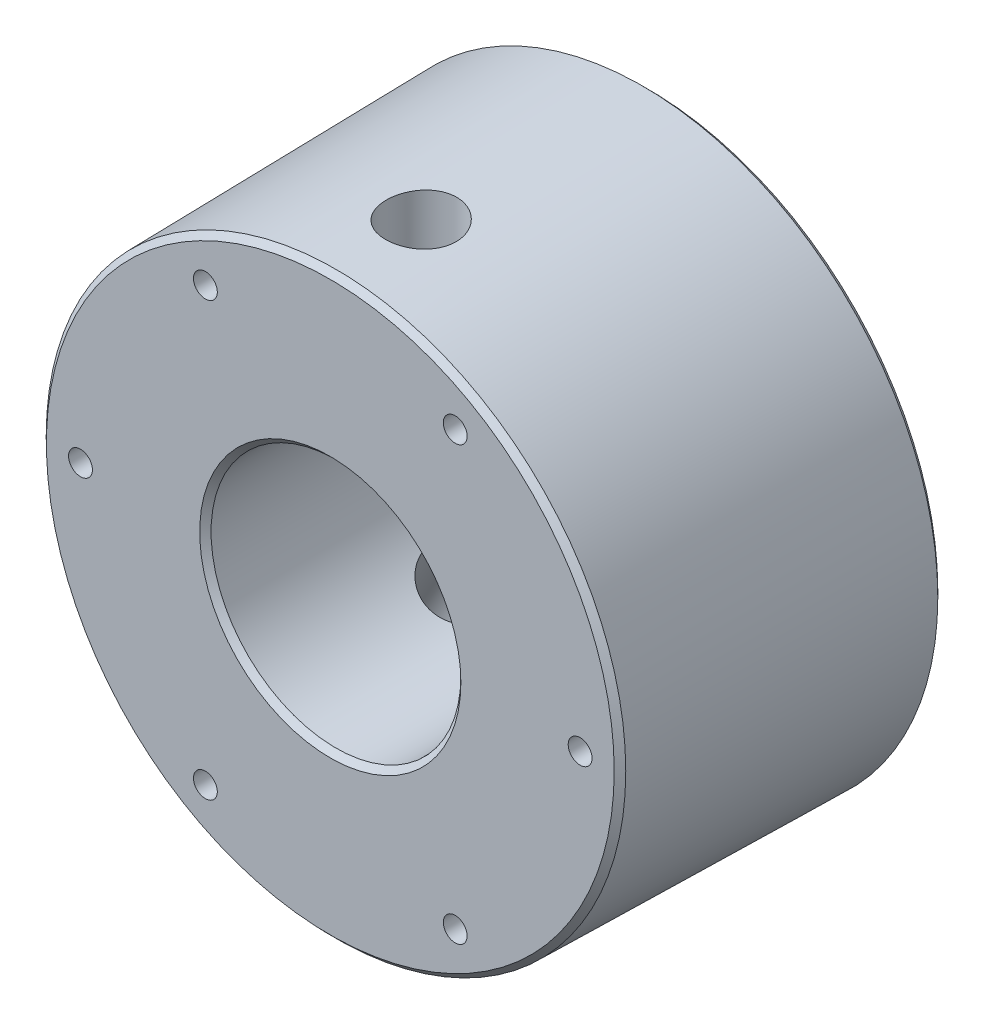
from build123d import *

# Parameters (mm, degrees)
SK_BODY_R          = 52
BODY_DRAFT1_DEPTH  = 56
BODY_DRAFT1_TAPER  = 1
SK_B20_R           = 10
CUT_B20_DEPTH      = 10
SK_PL0_W           = 27
SK_PL0_H           = 6.25
SK_CAV2_R          = 22
CUT_CAV44B_DEPTH   = 46
CUT_NOTCH120_DEPTH = 2
SK_H120_R          = 6.25
CUT_PL120C_DEPTH   = 26.9
CUT_NOTCH240_DEPTH = 2
SK_H240_R          = 6.25
CUT_PL240C_DEPTH   = 26.9
SK_P5_R            = 2.5
CUT_P5X3_DEPTH     = 22
CHAMFER_C1_SIZE    = 1
CHAMFER_C1_SIZE_2  = 0.982994102
CHAMFER_C1_SIZE_3  = 1.017920191
SK_M5V12_R         = 2.1
CUT_M5V12_DEPTH    = 16
SK_NOTCH90_W       = 2
SK_NOTCH90_H       = 0.8
CUT_NOTCH90_DEPTH  = 2
SK_OIL90_R         = 6.25
CUT_OIL90_DEPTH    = 22
SK_NOTCH270_W      = 2
SK_NOTCH270_H      = 0.8
CUT_NOTCH270_DEPTH = 2
CUT_OIL270_START   = 22
SK_OIL270_R        = 6.25
CUT_OIL270_DEPTH   = 22


with BuildPart() as part:
    # Sk_body → Body_draft1 (new body)
    with BuildSketch(Plane.XY):
        Circle(SK_BODY_R)
    extrude(amount=BODY_DRAFT1_DEPTH, taper=BODY_DRAFT1_TAPER)

    # Sk_b20 → Cut_b20 (cut)
    with BuildSketch(Plane.XY):
        Circle(SK_B20_R)
    extrude(amount=CUT_B20_DEPTH, mode=Mode.SUBTRACT)

    # Sk_pl0 → Cut_pl0 (revolve, cut)
    with BuildSketch(Plane.XY.offset(22), mode=Mode.PRIVATE) as cut_pl0_sk:
        with Locations((34.5, 3.125)):
            Rectangle(SK_PL0_W, SK_PL0_H)
    revolve(cut_pl0_sk.sketch.rotate(Axis((0, 0, 22), (1, 0, 0)), 90), axis=Axis((0, 0, 22), (1, 0, 0)), mode=Mode.SUBTRACT)

    # Sk_cav2 → Cut_cav44b (cut)
    with BuildSketch(Plane.XY.offset(10)):
        Circle(SK_CAV2_R)
    extrude(amount=CUT_CAV44B_DEPTH, mode=Mode.SUBTRACT)

    # Sk_notch120 → Cut_notch120 (cut)
    with BuildSketch(Plane.XY.offset(21)):
        Polygon((-24.466, 40.3764), (-22.734, 41.3764), (-23.134, 42.0692), (-24.866, 41.0692), align=None)
    extrude(amount=CUT_NOTCH120_DEPTH, mode=Mode.SUBTRACT)

    # Sk_h120 → Cut_pl120c (cut)
    with BuildSketch(Plane(origin=(-24.000519623, 41.568899987, 0), x_dir=(0.8660190526287386, 0.5000110003630143, 0), z_dir=(0.5000110003630142, -0.8660190526287385, 0))):
        with Locations(Location((0.000600013, 22, 0), (0, 0, 175.281583596))):
            Circle(SK_H120_R)
    extrude(amount=CUT_PL120C_DEPTH, mode=Mode.SUBTRACT)

    # Sk_notch240 → Cut_notch240 (cut)
    with BuildSketch(Plane.XY.offset(21)):
        Polygon((-22.734, -41.3764), (-24.466, -40.3764), (-24.866, -41.0692), (-23.134, -42.0692), align=None)
    extrude(amount=CUT_NOTCH240_DEPTH, mode=Mode.SUBTRACT)

    # Sk_h240 → Cut_pl240c (cut)
    with BuildSketch(Plane(origin=(-24.000519623, -41.568899987, 0), x_dir=(0.8660190526287386, -0.5000110003630143, 0), z_dir=(0.5000110003630142, 0.8660190526287385, 0))):
        with Locations(Location((0.000600013, -22, 0), (0, 0, 355.149686071))):
            Circle(SK_H240_R)
    extrude(amount=CUT_PL240C_DEPTH, mode=Mode.SUBTRACT)

    # Sk_p5 → Cut_p5x3 (cut)
    with BuildSketch(Plane.XY):
        with Locations(Location((26, 0, 0), (0, 0, 180))):
            Circle(SK_P5_R)
        with Locations(Location((-13, 22.5167, 0), (0, 0, 180))):
            Circle(SK_P5_R)
        with Locations(Location((-13, -22.5167, 0), (0, 0, 180))):
            Circle(SK_P5_R)
    extrude(amount=CUT_P5X3_DEPTH, mode=Mode.SUBTRACT)

    # Chamfer_C1
    # the kernel refuses this chamfer: 1.017920191, 1, 0.982994102 mm, written as the material it takes off along each edge
    with BuildSketch(Plane(origin=(0, 0, 56), x_dir=(1, 0, 0), z_dir=(0, -1, 0))) as chamfer_c1_piece_1:
        Polygon((22 + CHAMFER_C1_SIZE, 0), (22, -CHAMFER_C1_SIZE), (22, 0), align=None)
    revolve(axis=Axis((0, 0, 56), (0, 0, 1)), mode=Mode.SUBTRACT)
    with BuildSketch(Plane(origin=(0, 0, 10), x_dir=(1, 0, 0), z_dir=(0, -1, 0))) as chamfer_c1_piece_2:
        Polygon((10, -CHAMFER_C1_SIZE), (10 + CHAMFER_C1_SIZE, 0), (10, 0), align=None)
    revolve(axis=Axis((0, 0, 10), (0, 0, 1)), mode=Mode.SUBTRACT)
    with BuildSketch(Plane(origin=(0, 0, 0), x_dir=(1, 0, 0), z_dir=(0, -1, 0))) as chamfer_c1_piece_3:
        Polygon((10 + CHAMFER_C1_SIZE, 0), (10, CHAMFER_C1_SIZE), (10, 0), align=None)
    revolve(axis=Axis((0, 0, 0), (0, 0, 1)), mode=Mode.SUBTRACT)
    with BuildSketch(Plane(origin=(0, 0, 0), x_dir=(1, 0, 0), z_dir=(0, 1, 0))) as chamfer_c1_piece_4:
        Polygon((52 - CHAMFER_C1_SIZE, 0), (52 - CHAMFER_C1_SIZE_2 * 0.0174524064402, -CHAMFER_C1_SIZE_2 * 0.999847695326), (52, 0), align=None)
    revolve(axis=Axis((0, 0, 0), (0, 0, -1)), mode=Mode.SUBTRACT)
    with BuildSketch(Plane(origin=(0, 0, 56), x_dir=(1, 0, 0), z_dir=(0, 1, 0))) as chamfer_c1_piece_5:
        Polygon((51.022516364 + CHAMFER_C1_SIZE * 0.0174524064373, CHAMFER_C1_SIZE * 0.999847695156), (51.022516364 - CHAMFER_C1_SIZE_3, 0), (51.022516364, 0), align=None)
    revolve(axis=Axis((0, 0, 56), (0, 0, -1)), mode=Mode.SUBTRACT)

    # Sk_m5v12 → Cut_m5v12 (cut)
    with BuildSketch(Plane.XY.offset(40)):
        with Locations((44, 0)):
            Circle(SK_M5V12_R)
        with Locations((22, 38.1051)):
            Circle(SK_M5V12_R)
        with Locations((-22, 38.1051)):
            Circle(SK_M5V12_R)
        with Locations((-44, 0)):
            Circle(SK_M5V12_R)
        with Locations((-22, -38.1051)):
            Circle(SK_M5V12_R)
        with Locations((22, -38.1051)):
            Circle(SK_M5V12_R)
    extrude(amount=CUT_M5V12_DEPTH, mode=Mode.SUBTRACT)

    # Sk_notch90 → Cut_notch90 (cut)
    with BuildSketch(Plane.XY.offset(39)):
        with Locations((0, 30.4)):
            Rectangle(SK_NOTCH90_W, SK_NOTCH90_H)
    extrude(amount=CUT_NOTCH90_DEPTH, mode=Mode.SUBTRACT)

    # Sk_oil90 → Cut_oil90 (cut)
    with BuildSketch(Plane(origin=(0, 30, 0), x_dir=(1, 0, 0), z_dir=(0, 1, 0))):
        with Locations(Location((0, -40, 0), (0, 0, 135.962349207))):
            Circle(SK_OIL90_R)
    extrude(amount=CUT_OIL90_DEPTH, mode=Mode.SUBTRACT)

    # Sk_notch270 → Cut_notch270 (cut)
    with BuildSketch(Plane.XY.offset(39)):
        with Locations((0, -30.4)):
            Rectangle(SK_NOTCH270_W, SK_NOTCH270_H)
    extrude(amount=CUT_NOTCH270_DEPTH, mode=Mode.SUBTRACT)

    # Sk_oil270 → Cut_oil270 (cut)
    with BuildSketch(Plane.XZ.offset(30).offset(CUT_OIL270_START)):
        with Locations(Location((0, 40, 0), (0, 0, 224.037650793))):
            Circle(SK_OIL270_R)
    extrude(amount=-CUT_OIL270_DEPTH, mode=Mode.SUBTRACT)


solid = part.part
